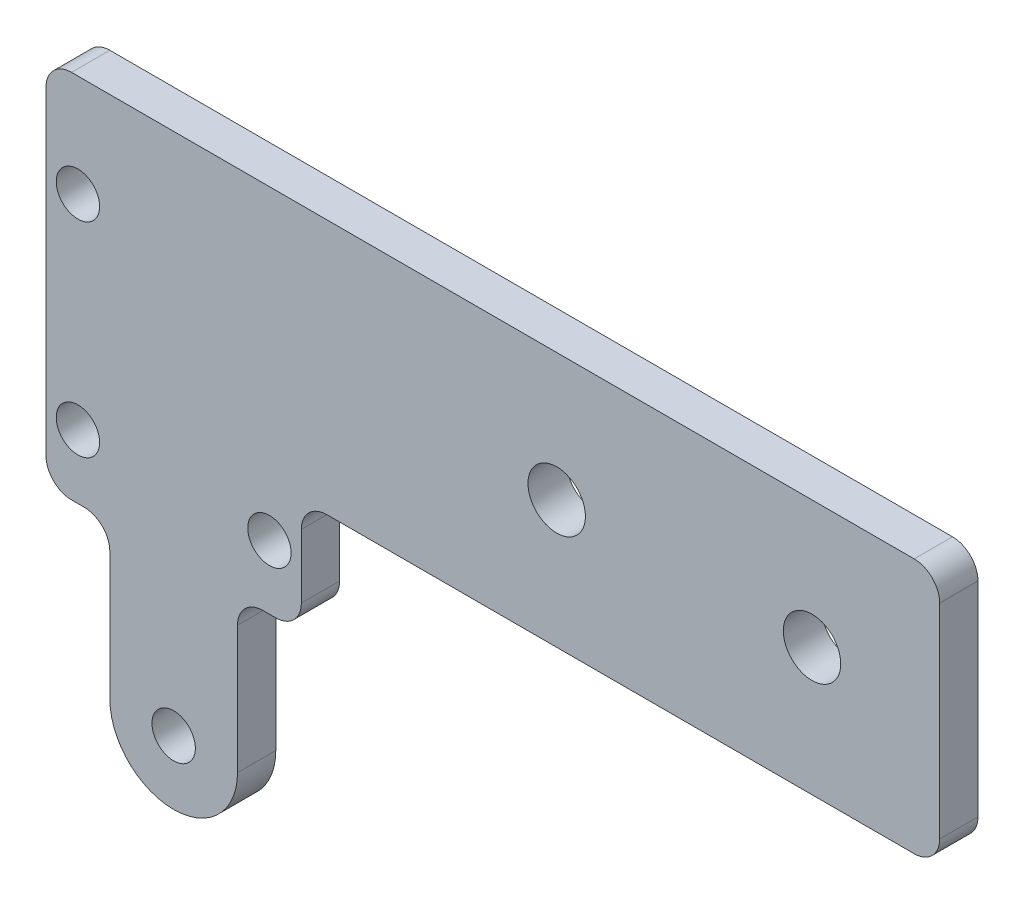
from build123d import *

# Parameters (mm, degrees)
AUFSATZ_LINEAR_AUSTRAGEN1_DEPTH = 3
SKIZZE2_R                       = 1.7
SCHNITT_LINEAR_AUSTRAGEN1_DEPTH = 57.435804238
DURCHGANGSLOCH_F_R_M41_D        = 4.5
DURCHGANGSLOCH_F_R_M31_D        = 3.4
VERRUNDUNG1_R                   = 2


with BuildPart() as part:
    # Skizze1 → Aufsatz-Linear austragen1 (new body)
    with BuildSketch(Plane.XY):
        with BuildLine():
            Line((0, 0), (0, -9))
            Line((0, -9), (-5, -9))
            Line((-5, -9), (-5, -21))
            ThreePointArc((-5, -21), (-10, -26), (-15, -21))
            Line((-15, -21), (-15, -9))
            Line((-15, -9), (-20, -9))
            Line((-20, -9), (-20, 20))
            Line((-20, 20), (50, 20))
            Line((50, 20), (50, 0))
            Line((50, 0), (0, 0))
        make_face()
    extrude(amount=AUFSATZ_LINEAR_AUSTRAGEN1_DEPTH)

    # Skizze2 → Schnitt-Linear austragen1 (cut, through all)
    with BuildSketch(Plane.XY.offset(3)):
        with Locations((-10, -21)):
            Circle(SKIZZE2_R)
    extrude(amount=-SCHNITT_LINEAR_AUSTRAGEN1_DEPTH, mode=Mode.SUBTRACT)

    # Durchgangsloch für M41 (through all)
    with Locations(Plane.XY.offset(3)):
        with Locations((20, 10), (40, 10)):
            Hole(DURCHGANGSLOCH_F_R_M41_D / 2)

    # Durchgangsloch für M31 (through all)
    with Locations(Plane.XY.offset(3)):
        with Locations((-17.5, 12), (-2.5, -4), (-17.5, -4)):
            Hole(DURCHGANGSLOCH_F_R_M31_D / 2)

    # Verrundung1
    verrundung1_edges = [part.edges().sort_by_distance(p)[0] for p in [
        (-20, -9, 1.5),
        (-15, -9, 1.5),
        (-5, -9, 1.5),
        (0, -9, 1.5),
        (0, 0, 1.5),
        (50, 0, 1.5),
        (-20, 20, 1.5),
        (50, 20, 1.5),
    ]]
    fillet(verrundung1_edges, radius=VERRUNDUNG1_R)


solid = part.part
